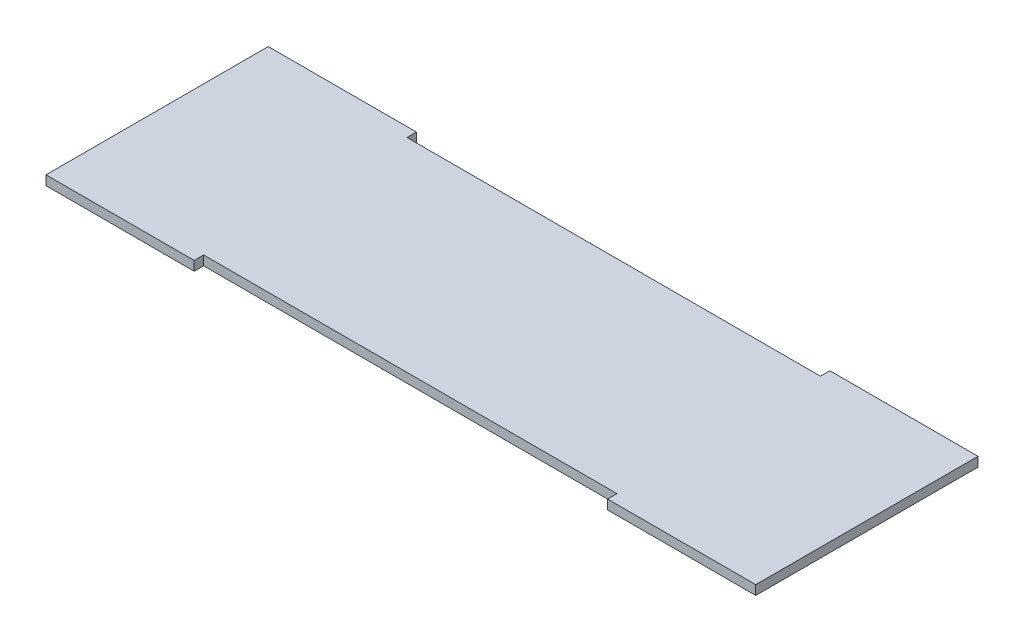
from build123d import *

# Parameters (mm, degrees)
BOSS_EXTRUDE1_DEPTH = 3.175


with BuildPart() as part:
    # Sketch1 → Boss-Extrude1 (new, symmetric)
    with BuildSketch(Plane(origin=(0, 0, 0), x_dir=(1, 0, 0), z_dir=(0, 1, 0))):
        Polygon((-239.5, 75), (-239.5, -75), (-139.5, -75), (-139.5, -68.65), (139.5, -68.65), (139.5, -75), (239.5, -75), (239.5, 75), (139.5, 75), (139.5, 68.65), (-139.5, 68.65), (-139.5, 75), align=None)
    extrude(amount=BOSS_EXTRUDE1_DEPTH, both=True)


solid = part.part
